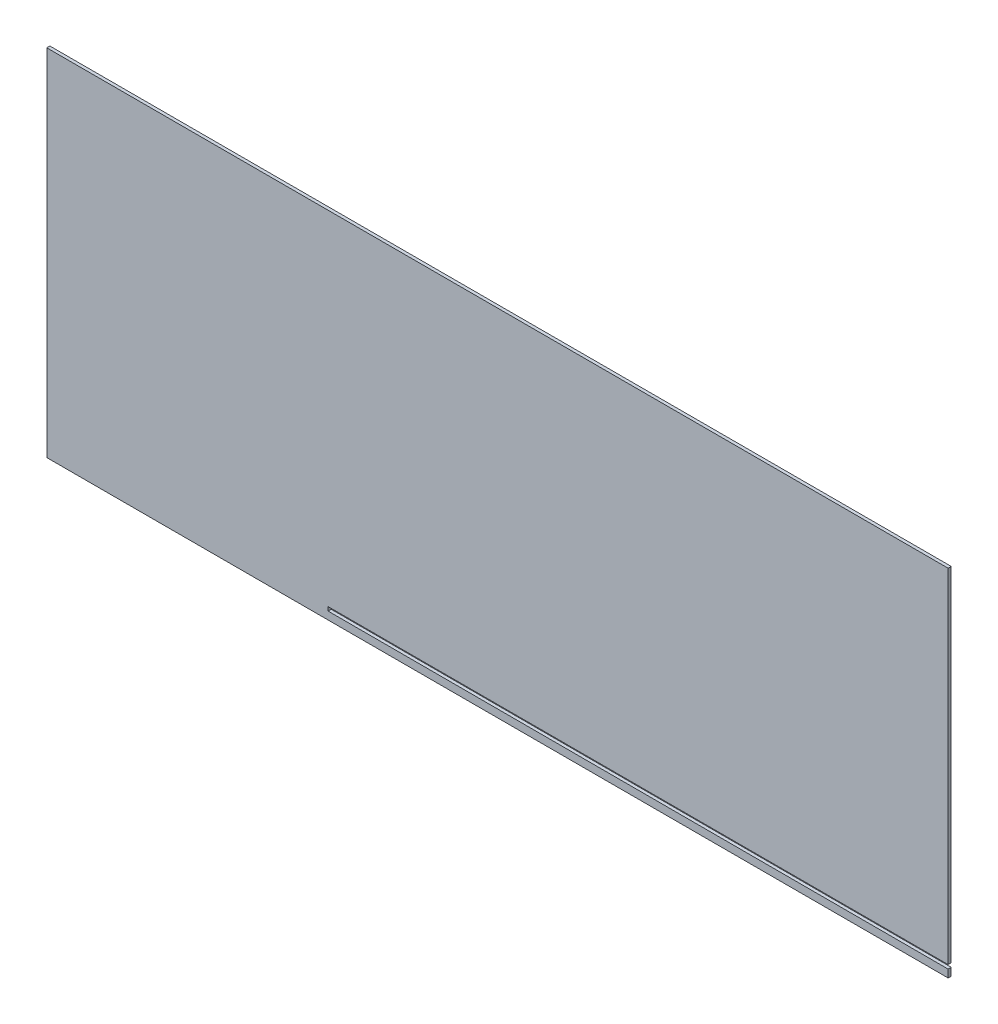
from build123d import *

# Parameters (mm, degrees)
SKETCH1_W           = 581.59
SKETCH1_H           = 229
BOSS_EXTRUDE1_DEPTH = 2
SKETCH2_W           = 400
SKETCH2_H           = 2.5
CUT_EXTRUDE1_DEPTH  = 10


with BuildPart() as part:
    # Sketch1 → Boss-Extrude1 (new body)
    with BuildSketch(Plane.XY):
        with Locations((290.795, 114.5)):
            Rectangle(SKETCH1_W, SKETCH1_H)
    extrude(amount=BOSS_EXTRUDE1_DEPTH)

    # Sketch2 → Cut-Extrude1 (cut)
    with BuildSketch(Plane(origin=(0, 0, 0), x_dir=(-1, 0, 0), z_dir=(0, 0, -1))):
        with Locations((-381.59, 6.25)):
            Rectangle(SKETCH2_W, SKETCH2_H)
    extrude(amount=-CUT_EXTRUDE1_DEPTH, mode=Mode.SUBTRACT)


solid = part.part
